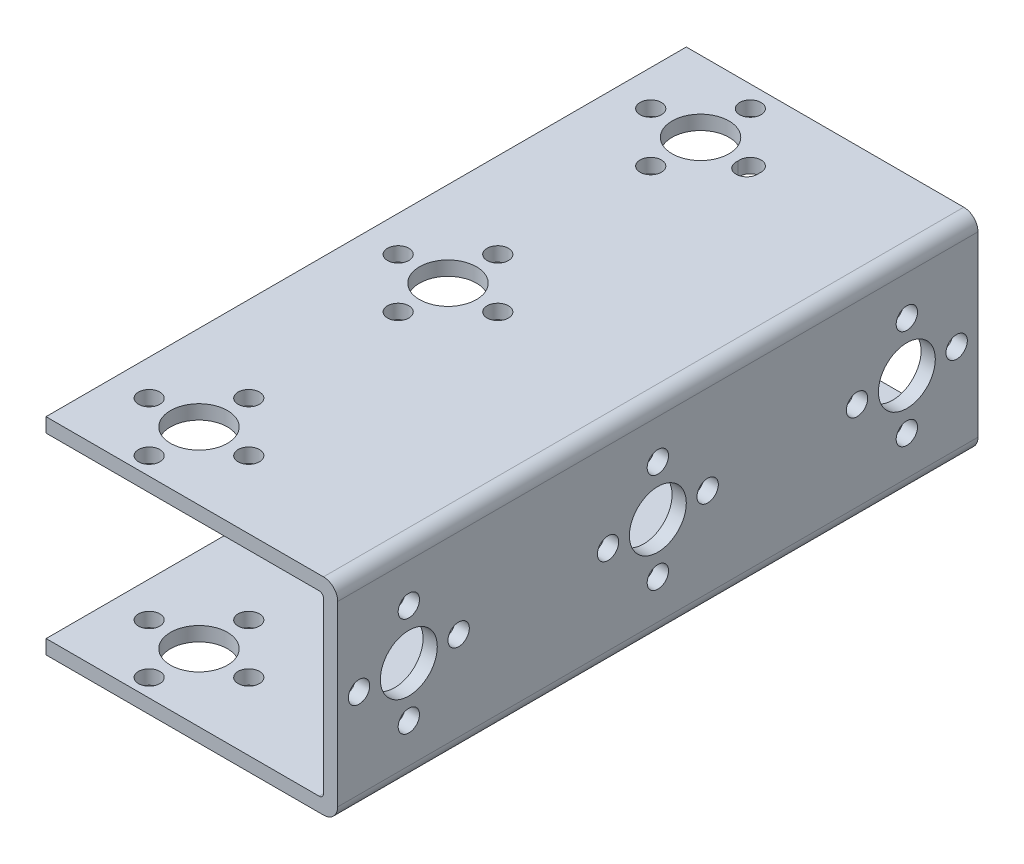
from build123d import *

# Parameters (mm, degrees)
BOSS_EXTRUDE1_DEPTH      = 90
SKETCH4_R                = 1.5
SKETCH4_R_2              = 4
CUT_EXTRUDE1_DEPTH       = 31
CUT_EXTRUDE2_START       = -29
CUT_EXTRUDE2_OUTLINE_R   = 4
CUT_EXTRUDE2_OUTLINE_R_2 = 1.5
CUT_EXTRUDE2_DEPTH       = 29
SKETCH8_R                = 4
SKETCH8_R_2              = 1.5
CUT_EXTRUDE3_DEPTH       = 10


# Read off the part's stored shape, not the designer's step: Cut-Extrude2
with BuildPart() as part:
    # Sketch3 → Boss-Extrude1 (new body)
    with BuildSketch(Plane.XY):
        with BuildLine():
            Line((-2, 0.049393959), (-41, 0.049393959))
            Line((-41, 0.049393959), (-41, 2.049393959))
            Line((-41, 2.049393959), (-2.618272552, 2.049393959))
            ThreePointArc((-2.618272552, 2.049393959), (-2.194008483, 2.22512989), (-2.018272552, 2.649393959))
            Line((-2.018272552, 2.649393959), (-2.018272552, 26.449393959))
            ThreePointArc((-2.018272552, 26.449393959), (-2.194008483, 26.873658027), (-2.618272552, 27.049393959))
            Line((-2.618272552, 27.049393959), (-41.018189082, 27.049393959))
            Line((-41.018189082, 27.049393959), (-41.018189082, 29.049393959))
            Line((-41.018189082, 29.049393959), (-2.018189082, 29.049393959))
            ThreePointArc((-2.018189082, 29.049393959), (-0.60397552, 28.463607521), (-0.018189082, 27.049393959))
            Line((-0.018189082, 27.049393959), (-0.018189082, 2.049393959))
            ThreePointArc((-0.018189082, 2.049393959), (-0.597554333, 0.64159652), (-2, 0.049393959))
        make_face()
    extrude(amount=BOSS_EXTRUDE1_DEPTH)

    # Sketch4 → Cut-Extrude1 (cut)
    with BuildSketch(Plane(origin=(0, 29.049393959, 0), x_dir=(1, 0, 0), z_dir=(0, 1, 0))):
        with Locations(Location((-29.018189082, -3, 0), (0, 0, 180))):
            Circle(SKETCH4_R)
        with Locations(Location((-36.018189082, -10, 0), (0, 0, 180))):
            Circle(SKETCH4_R)
        with Locations(Location((-29.018189082, -10, 0), (0, 0, 180))):
            Circle(SKETCH4_R_2)
        with Locations(Location((-22.018189082, -10, 0), (0, 0, 180))):
            Circle(SKETCH4_R)
        with Locations(Location((-29.018189082, -17, 0), (0, 0, 180))):
            Circle(SKETCH4_R)
    extrude(amount=-CUT_EXTRUDE1_DEPTH, mode=Mode.SUBTRACT)

    # Cut-Extrude2 outline → Cut-Extrude2 (cut)
    with BuildSketch(Plane(origin=(0, 29.049393959, 0), x_dir=(1, 0, 0), z_dir=(0, 1, 0)).offset(CUT_EXTRUDE2_START)):
        with BuildLine():
            ThreePointArc((-20.539075604, -10.249446027), (-22.018189082, -11.5), (-23.49730256, -10.249446027))
            ThreePointArc((-23.49730256, -10.249446027), (-22.018189083, -11.998892055), (-20.539075604, -10.249446027))
        make_face()
        with Locations((-29.018189082, -45.498892055)):
            Circle(CUT_EXTRUDE2_OUTLINE_R)
        with Locations((-29.018189082, -87.498892055)):
            Circle(CUT_EXTRUDE2_OUTLINE_R_2)
        with Locations((-22.018189082, -80.498892055)):
            Circle(CUT_EXTRUDE2_OUTLINE_R_2)
        with Locations((-29.018189082, -73.498892055)):
            Circle(CUT_EXTRUDE2_OUTLINE_R_2)
        with Locations((-29.018189082, -52.498892055)):
            Circle(CUT_EXTRUDE2_OUTLINE_R_2)
        with Locations((-36.018189082, -80.498892055)):
            Circle(CUT_EXTRUDE2_OUTLINE_R_2)
        with Locations((-36.018189082, -45.498892055)):
            Circle(CUT_EXTRUDE2_OUTLINE_R_2)
        with Locations((-29.018189082, -80.498892055)):
            Circle(CUT_EXTRUDE2_OUTLINE_R)
        with Locations((-22.018189082, -45.498892055)):
            Circle(CUT_EXTRUDE2_OUTLINE_R_2)
        with Locations((-29.018189082, -38.498892055)):
            Circle(CUT_EXTRUDE2_OUTLINE_R_2)
    extrude(amount=CUT_EXTRUDE2_DEPTH, mode=Mode.SUBTRACT)

    # Sketch8 → Cut-Extrude3 (cut)
    with BuildSketch(Plane(origin=(0, 0, 0), x_dir=(0, 0, -1), z_dir=(1, 0, 0))):
        with Locations((-10, 14.549393959)):
            Circle(SKETCH8_R)
        with Locations((-3, 14.549393959)):
            Circle(SKETCH8_R_2)
        with Locations((-10, 21.549393959)):
            Circle(SKETCH8_R_2)
        with Locations((-10, 7.549393959)):
            Circle(SKETCH8_R_2)
        with Locations((-17, 14.549393959)):
            Circle(SKETCH8_R_2)
        with Locations((-52, 14.549393959)):
            Circle(SKETCH8_R_2)
        with Locations((-45, 7.549393959)):
            Circle(SKETCH8_R_2)
        with Locations((-38, 14.549393959)):
            Circle(SKETCH8_R_2)
        with Locations((-45, 21.549393959)):
            Circle(SKETCH8_R_2)
        with Locations((-45, 14.549393959)):
            Circle(SKETCH8_R)
        with Locations((-73, 14.549393959)):
            Circle(SKETCH8_R_2)
        with Locations((-80, 7.549393959)):
            Circle(SKETCH8_R_2)
        with Locations((-80, 14.549393959)):
            Circle(SKETCH8_R)
        with Locations((-87, 14.549393959)):
            Circle(SKETCH8_R_2)
        with Locations((-80, 21.549393959)):
            Circle(SKETCH8_R_2)
    extrude(amount=-CUT_EXTRUDE3_DEPTH, mode=Mode.SUBTRACT)


solid = part.part
